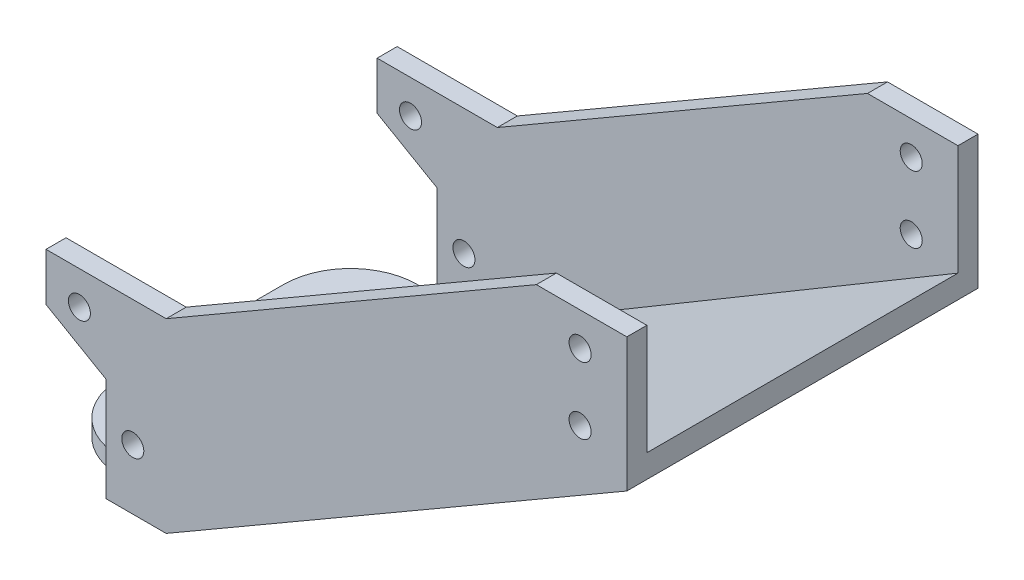
from build123d import *

# Parameters (mm, degrees)
SKETCH1_R                                      = 1.65
BOSS_EXTRUDE1_DEPTH                            = 3
SKETCH1_3_W                                    = 9
SKETCH1_3_H                                    = 2.5
BOSS_EXTRUDE2_DEPTH                            = 46.6
BOSS_EXTRUDE3_START                            = -49.6
SKETCH1_4_R                                    = 1.65
SKETCH1_4_W                                    = 9
SKETCH1_4_H                                    = 2.5
BOSS_EXTRUDE3_DEPTH                            = 3
CUT_EXTRUDE1_DEPTH                             = 88.5
SKETCH3_W                                      = 44.6
SKETCH3_H                                      = 2.5
BOSS_EXTRUDE4_DEPTH                            = 12
FILLET1_R                                      = 10
CSK_START                                      = -9
CSK_SLOT_FOR_M3_COUNTERSUNK_FLAT_HEAD_SC_DEPTH = 3


with BuildPart() as part:
    # Sketch1 → Boss-Extrude1 (new body)
    with BuildSketch(Plane.XY):
        Polygon((-13, 18.856406461), (-13, 11.696152423), (-4, 6.5), (-4, -9), (5, -9), (74, 31), (74, 51), (60.447698856, 51), (5, 18.856406461), align=None)
        Circle(SKETCH1_R, mode=Mode.SUBTRACT)
        with Locations((-8, 13.856406461)):
            Circle(SKETCH1_R, mode=Mode.SUBTRACT)
        with Locations((67, 46)):
            Circle(SKETCH1_R, mode=Mode.SUBTRACT)
        with Locations((67, 36)):
            Circle(SKETCH1_R, mode=Mode.SUBTRACT)
    extrude(amount=BOSS_EXTRUDE1_DEPTH)

    # Sketch1<3> → Boss-Extrude2 (add)
    with BuildSketch(Plane.XY):
        with Locations((0.5, -7.75)):
            Rectangle(SKETCH1_3_W, SKETCH1_3_H)
        Polygon((74, 34.467646849), (5, -6.5), (5, -9), (74, 31), align=None)
    extrude(amount=-BOSS_EXTRUDE2_DEPTH)

    # Sketch1<4> → Boss-Extrude3 (add)
    # profile 1 of 4: a face of its own
    with BuildSketch(Plane.XY.offset(BOSS_EXTRUDE3_START)):
        Polygon((5, 18.856406461), (-13, 18.856406461), (-13, 11.696152423), (-4, 6.5), (-4, -6.5), (5, -6.5), align=None)
        Circle(SKETCH1_4_R, mode=Mode.SUBTRACT)
        with Locations((-8, 13.856406461)):
            Circle(SKETCH1_4_R, mode=Mode.SUBTRACT)
    # profile 2 of 4: a face of its own
    with BuildSketch(Plane.XY.offset(BOSS_EXTRUDE3_START)):
        with Locations((0.5, -7.75)):
            Rectangle(SKETCH1_4_W, SKETCH1_4_H)
    # profile 3 of 4: a face of its own
    with BuildSketch(Plane.XY.offset(BOSS_EXTRUDE3_START)):
        Polygon((74, 34.467646849), (5, -6.5), (5, -9), (74, 31), align=None)
    # profile 4 of 4: a face of its own
    with BuildSketch(Plane.XY.offset(BOSS_EXTRUDE3_START)):
        Polygon((60.447698856, 51), (5, 18.856406461), (5, -6.5), (74, 34.467646849), (74, 51), align=None)
        with Locations((67, 36)):
            Circle(SKETCH1_4_R, mode=Mode.SUBTRACT)
        with Locations((67, 46)):
            Circle(SKETCH1_4_R, mode=Mode.SUBTRACT)
    extrude(amount=BOSS_EXTRUDE3_DEPTH)

    # Sketch2 → Cut-Extrude1 (cut)
    with BuildSketch(Plane.XZ.offset(9)):
        with BuildLine():
            Line((1, -24.95), (-1, -24.95))
            ThreePointArc((-1, -24.95), (-2.65, -23.3), (-1, -21.65))
            Line((-1, -21.65), (1, -21.65))
            ThreePointArc((1, -21.65), (2.65, -23.3), (1, -24.95))
        make_face()
    extrude(amount=-CUT_EXTRUDE1_DEPTH, mode=Mode.SUBTRACT)

    # Sketch3 → Boss-Extrude4 (add)
    with BuildSketch(Plane.ZY.offset(4)):
        with Locations((-23.3, -7.75)):
            Rectangle(SKETCH3_W, SKETCH3_H)
    extrude(amount=BOSS_EXTRUDE4_DEPTH)

    # Fillet1
    fillet1_edges = [part.edges().sort_by_distance(p)[0] for p in [
        (-16, -7.75, -45.6),
        (-16, -7.75, -1),
    ]]
    fillet(fillet1_edges, radius=FILLET1_R)

    # CSK SLOT for M3 Countersunk Flat Head Screw1: read off the stored shape, not the designer's step
    # CSK SLOT for M3 Countersunk Flat Hea 2 → CSK SLOT for M3 Countersunk Flat Head Screw1 (cut)
    with BuildSketch(Plane(origin=(0, 0, 0), x_dir=(1, 0, 0), z_dir=(0, 1, 0)).offset(CSK_START)):
        with BuildLine():
            ThreePointArc((-1.7125, 21.811764888), (-1.229705955, 21.579705955), (-0.7, 21.5))
            Line((-0.7, 21.5), (0.7, 21.5))
            ThreePointArc((0.7, 21.5), (1.229705955, 21.579705955), (1.7125, 21.811764888))
            ThreePointArc((1.7125, 21.811764888), (1.365316345, 21.690949358), (1, 21.65))
            Line((1, 21.65), (-1, 21.65))
            ThreePointArc((-1, 21.65), (-1.365316345, 21.690949358), (-1.7125, 21.811764888))
        make_face()
        with BuildLine():
            ThreePointArc((-0.7, 25.1), (-1.229705955, 25.020294045), (-1.7125, 24.788235112))
            ThreePointArc((-1.7125, 24.788235112), (-1.365316345, 24.909050642), (-1, 24.95))
            Line((-1, 24.95), (1, 24.95))
            ThreePointArc((1, 24.95), (1.365316345, 24.909050642), (1.7125, 24.788235112))
            ThreePointArc((1.7125, 24.788235112), (1.229705955, 25.020294045), (0.7, 25.1))
            Line((0.7, 25.1), (-0.7, 25.1))
        make_face()
    extrude(amount=CSK_SLOT_FOR_M3_COUNTERSUNK_FLAT_HEAD_SC_DEPTH, mode=Mode.SUBTRACT)

    # CSK SLOT for M3 Countersunk Flat Hea 3: loft between two sections, ruled curve by curve
    csk_slot_for_m3_countersunk_flat_hea_3_from = [
        Edge.make_three_point_arc((0.7, -7.649999999, -25.099999999), (1.972792205, -7.649999999, -24.572792205), (2.499999999, -7.649999999, -23.3)),
        Edge.make_three_point_arc((2.499999999, -7.649999999, -23.3), (1.972792205, -7.649999999, -22.027207795), (0.7, -7.649999999, -21.500000001)),
        Edge.make_three_point_arc((-0.7, -7.649999999, -21.500000001), (-1.972792205, -7.649999999, -22.027207795), (-2.499999999, -7.649999999, -23.3)),
        Edge.make_three_point_arc((-2.499999999, -7.649999999, -23.3), (-1.972792205, -7.649999999, -24.572792205), (-0.7, -7.649999999, -25.099999999)),
        Edge.make_line((0.7, -7.649999999, -21.500000001), (-0.7, -7.649999999, -21.500000001)),
        Edge.make_line((0.7, -7.649999999, -25.099999999), (-0.7, -7.649999999, -25.099999999)),
    ]
    csk_slot_for_m3_countersunk_flat_hea_3_to = [
        Edge.make_three_point_arc((0.7, -9, -26.45), (2.927386361, -9, -25.527386361), (3.85, -9, -23.3)),
        Edge.make_three_point_arc((3.85, -9, -23.3), (2.927386361, -9, -21.072613639), (0.7, -9, -20.15)),
        Edge.make_three_point_arc((-0.7, -9, -20.15), (-2.927386361, -9, -21.072613639), (-3.85, -9, -23.3)),
        Edge.make_three_point_arc((-3.85, -9, -23.3), (-2.927386361, -9, -25.527386361), (-0.7, -9, -26.45)),
        Edge.make_line((0.7, -9, -20.15), (-0.7, -9, -20.15)),
        Edge.make_line((0.7, -9, -26.45), (-0.7, -9, -26.45)),
    ]
    csk_slot_for_m3_countersunk_flat_hea_3 = Solid(Shell([*[Face.make_surface_from_curves(csk_slot_for_m3_countersunk_flat_hea_3_from[k], csk_slot_for_m3_countersunk_flat_hea_3_to[k]) for k in range(6)], Face(Wire(csk_slot_for_m3_countersunk_flat_hea_3_from)), Face(Wire(csk_slot_for_m3_countersunk_flat_hea_3_to))]))
    add(csk_slot_for_m3_countersunk_flat_hea_3, mode=Mode.SUBTRACT)


solid = part.part
